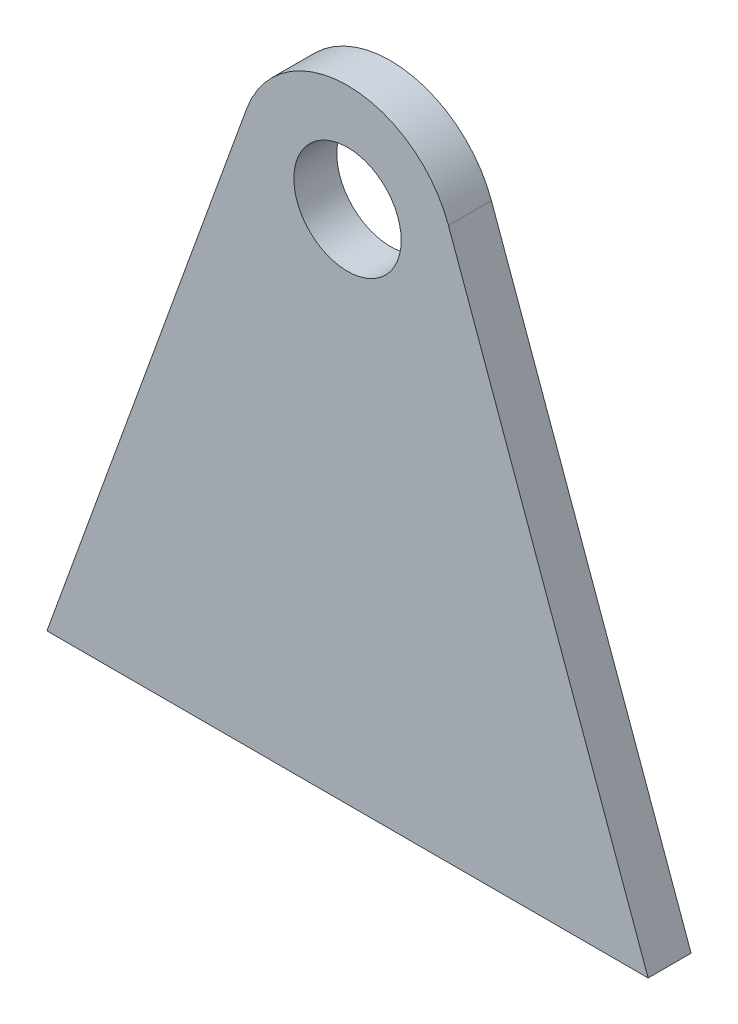
from build123d import *

# Parameters (mm, degrees)
BOSS_EXTRUDE1_DEPTH      = 10
BOSS_EXTRUDE1_DEPTH_BACK = 10
SKETCH1_R                = 25


with BuildPart() as part:
    # Sketch1 → Boss-Extrude1 (new, two sides: drawn at the far end of the back side and taken through both)
    with BuildSketch(Plane.XY.offset(-BOSS_EXTRUDE1_DEPTH_BACK)):
        with BuildLine():
            Line((-140, -240), (140, -240))
            Line((140, -240), (47.017565913, 17.010246783))
            ThreePointArc((47.017565913, 17.010246783), (0, 50), (-47.017565913, 17.010246783))
            Line((-47.017565913, 17.010246783), (-140, -240))
        make_face()
        Circle(SKETCH1_R, mode=Mode.SUBTRACT)
    extrude(amount=BOSS_EXTRUDE1_DEPTH + BOSS_EXTRUDE1_DEPTH_BACK)


solid = part.part
